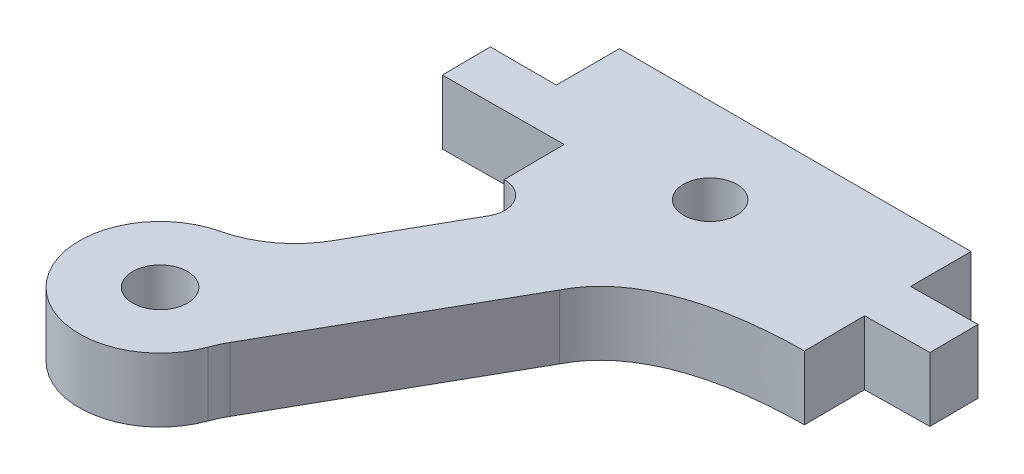
from build123d import *

# Parameters (mm, degrees)
SKETCH1_R           = 1.36
SKETCH1_R_2         = 1.3250121
BOSS_EXTRUDE1_DEPTH = 3.175


with BuildPart() as part:
    # Sketch1 → Boss-Extrude1 (new body)
    with BuildSketch(Plane(origin=(0, 0, 0), x_dir=(1, 0, 0), z_dir=(0, 1, 0))):
        with BuildLine():
            Line((112.732160584, 126.637337226), (112.754060584, 123.637337226))
            ThreePointArc((112.754060584, 123.637337226), (113.911255441, 122.994563634), (113.908760584, 121.670837226))
            Line((113.908760584, 121.670837226), (111.132177911, 116.779249754))
            ThreePointArc((111.132177911, 116.779249754), (109.782218466, 115.246237148), (107.931829776, 114.381032059))
            ThreePointArc((107.931829776, 114.381032059), (105.856876562, 107.834596546), (112.605009001, 109.108942394))
            ThreePointArc((112.605009001, 109.108942394), (112.762298979, 109.488310709), (112.950192113, 109.853490972))
            Line((112.950192113, 109.853490972), (118.859860584, 120.264637226))
            add(Edge.make_bspline(
                [(118.859860584, 120.264637226), (120.417960584, 123.358437226), (125.111960584, 123.707437226), (127.553760584, 123.725237226)],
                knots=[0.666666667, 0.666666667, 0.666666667, 0.666666667, 0.708333333, 0.708333333, 0.708333333, 0.708333333], degree=3))
            Line((127.553760584, 123.725237226), (127.532160584, 126.725237226))
            Line((127.532160584, 126.725237226), (130.731660584, 126.769137226))
            Line((130.731660584, 126.769137226), (130.714060584, 129.169037226))
            Line((130.714060584, 129.169037226), (127.414260584, 129.125137226))
            Line((127.414260584, 129.125137226), (127.414260584, 132.125037226))
            Line((127.414260584, 132.125037226), (109.989460584, 132.125037226))
            Line((109.989460584, 132.125037226), (109.989460584, 128.993237226))
            Line((109.989460584, 128.993237226), (106.714760584, 128.993237226))
            Line((106.714760584, 128.993237226), (106.732360587, 126.593336859))
            Line((106.732360587, 126.593336859), (112.732160584, 126.637337226))
        make_face()
        with Locations((108.850210584, 110.487887226)):
            Circle(SKETCH1_R, mode=Mode.SUBTRACT)
        with Locations((118.723210584, 127.881187226)):
            Circle(SKETCH1_R_2, mode=Mode.SUBTRACT)
    extrude(amount=BOSS_EXTRUDE1_DEPTH)


solid = part.part
